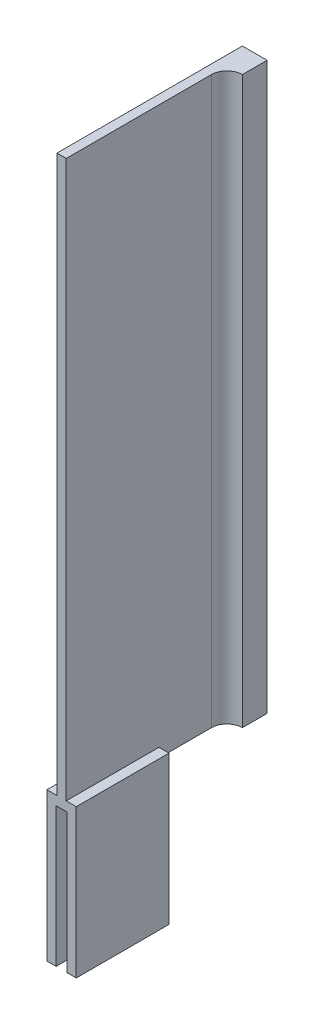
from build123d import *

# Parameters (mm, degrees)
SKETCH_1_W          = 3
SKETCH_1_H          = 45
EXTRUDE_1_DEPTH     = 30
EXTRUDE_1_2_DEPTH   = 30
SKETCH_2_W          = 9.5
SKETCH_2_H          = 30
EXTRUDE_2_DEPTH     = 3
SKETCH_3_W          = 3
SKETCH_3_H          = 60
EXTRUDE_3_DEPTH     = 180
SKETCH_4_W          = 5
SKETCH_4_H          = 8
EXTRUDE_4_DEPTH     = 180
FILLET_4_R          = 5
CUT_EXTRUDE_START   = -18
SKETCH_5_W          = 60.08866788
SKETCH_5_H          = 228
CUT_EXTRUDE_1_DEPTH = 11.25
EXTRUDE_5_DEPTH     = 3


with BuildPart() as part:
    # 草图1 → 凸台-拉伸1 (new body)
    with BuildSketch(Plane.XY):
        with Locations((1.5, 22.5)):
            Rectangle(SKETCH_1_W, SKETCH_1_H)
    extrude(amount=EXTRUDE_1_DEPTH)



with BuildPart() as body_2:
    # 草图1 → Extrude 1 2 (new body)
    with BuildSketch(Plane.XY):
        with Locations((8, 22.5)):
            Rectangle(SKETCH_1_W, SKETCH_1_H)
    extrude(amount=EXTRUDE_1_2_DEPTH)


with BuildPart() as part_1:
    add(part.part)

    add(body_2.part)  # 凸台-拉伸2 merges body 2
    # 草图2 → 凸台-拉伸2 (add)
    with BuildSketch(Plane(origin=(0, 45, 0), x_dir=(1, 0, 0), z_dir=(0, 1, 0))):
        with Locations((4.75, -15)):
            Rectangle(SKETCH_2_W, SKETCH_2_H)
    extrude(amount=EXTRUDE_2_DEPTH)

    # 草图3 → 凸台-拉伸3 (add)
    with BuildSketch(Plane(origin=(0, 48, 0), x_dir=(1, 0, 0), z_dir=(0, 1, 0))):
        with Locations((4.75, 0)):
            Rectangle(SKETCH_3_W, SKETCH_3_H)
    extrude(amount=EXTRUDE_3_DEPTH)

    # 草图4 → 凸台-拉伸4 (add)
    with BuildSketch(Plane(origin=(0, 228, 0), x_dir=(1, 0, 0), z_dir=(0, 1, 0))):
        with Locations((0.75, 26)):
            Rectangle(SKETCH_4_W, SKETCH_4_H)
    extrude(amount=-EXTRUDE_4_DEPTH)

    # 圆角4
    fillet_4_edges = [part_1.edges().sort_by_distance(p)[0] for p in [
        (3.25, 138, -22),
    ]]
    fillet(fillet_4_edges, radius=FILLET_4_R - 0.0001)  # a hair under: the kernel refuses the full size


with BuildPart() as body_2_2:
    # 镜向3: mirrored copy
    add(part_1.part.mirror(Plane(origin=(16.25, 0, 0), x_dir=(0, 0, 1), z_dir=(1, 0, 0))))

    # 草图6 → 凸台-拉伸5 (add)
    with BuildSketch(Plane.XZ.offset(-48)):
        with BuildLine():
            Line((26.25, 0), (26.25, -30))
            Line((26.25, -30), (34.25, -30))
            Line((34.25, -30), (34.25, -22))
            ThreePointArc((34.25, -22), (30.714466094, -20.535533906), (29.25, -17))
            Line((29.25, -17), (29.25, 0))
            Line((29.25, 0), (26.25, 0))
        make_face()
    extrude(amount=EXTRUDE_5_DEPTH)


with BuildPart() as part_2:
    add(part_1.part)

    # 草图5 → 切除-拉伸1 (cut)
    with BuildSketch(Plane(origin=(16.25, 0, 0), x_dir=(0, 0, -1), z_dir=(1, 0, 0)).offset(CUT_EXTRUDE_START)):
        with Locations((0.04433394, 114)):
            Rectangle(SKETCH_5_W, SKETCH_5_H)
    extrude(amount=CUT_EXTRUDE_1_DEPTH, mode=Mode.SUBTRACT)


solid = body_2_2.part
